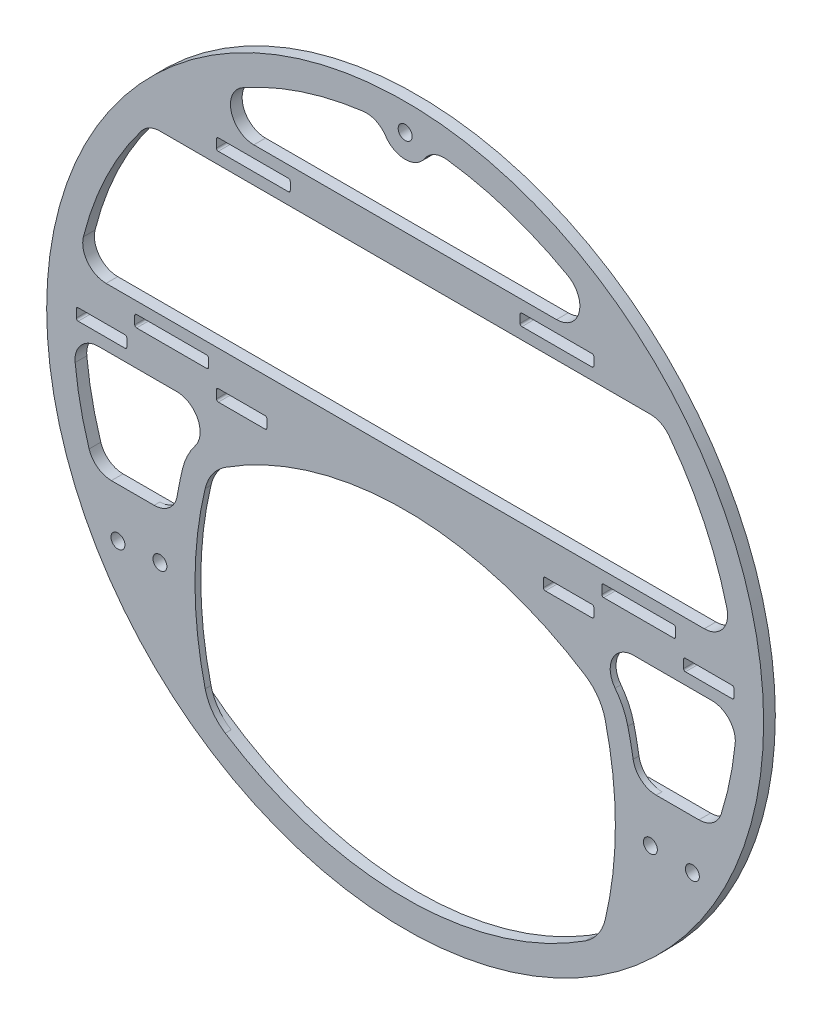
from build123d import *

# Parameters (mm, degrees)
SKETCH1_R             = 97.4725
SKETCH1_R_2           = 90.17
BOSS_EXTRUDE1_DEPTH   = 1.5875
BOSS_EXTRUDE2_START   = -3.175
BOSS_EXTRUDE2_DEPTH   = 3.175
CIRPATTERN2_COUNT     = 3
BOSS_EXTRUDE3_DEPTH   = 1.5875
BOSS_EXTRUDE4_START   = -3.175
BOSS_EXTRUDE4_DEPTH   = 3.175
FILLET2_R             = 6.35
F_6_CLEARANCE_HOLE1_D = 3.7973
BOSS_EXTRUDE5_START   = -3.175
SKETCH13_W            = 13.716
SKETCH13_H            = 3.175
BOSS_EXTRUDE5_DEPTH   = 3.175
SKETCH14_W            = 13.716
SKETCH14_H            = 3.175
CUT_EXTRUDE1_DEPTH    = 138.883491171
BOSS_EXTRUDE6_START   = -3.175
BOSS_EXTRUDE6_DEPTH   = 3.175
BOSS_EXTRUDE7_START   = -3.175
SKETCH16_W            = 20.066
SKETCH16_H            = 3.175
BOSS_EXTRUDE7_DEPTH   = 3.175
FILLET3_R             = 6.35
FILLET4_R             = 0.508


with BuildPart() as part:
    # Sketch1 → Boss-Extrude1 (new, symmetric)
    with BuildSketch(Plane.XY):
        Circle(SKETCH1_R)
        Circle(SKETCH1_R_2, mode=Mode.SUBTRACT)
    extrude(amount=BOSS_EXTRUDE1_DEPTH, both=True)

    # Sketch2 → Boss-Extrude2 (add)
    with BuildSketch(Plane.XY.offset(1.5875).offset(BOSS_EXTRUDE2_START)):
        with BuildLine():
            ThreePointArc((-5.291472464, 86.659612676), (0, 83.82), (5.291472464, 86.659612676))
            ThreePointArc((5.291472464, 86.659612676), (7.940261692, 88.923194985), (11.38468318, 89.448409091))
            ThreePointArc((11.38468318, 89.448409091), (0, 90.17), (-11.38468318, 89.448409091))
            ThreePointArc((-11.38468318, 89.448409091), (-7.940261692, 88.923194985), (-5.291472464, 86.659612676))
        make_face()
    boss_extrude2 = extrude(amount=BOSS_EXTRUDE2_DEPTH)

    # Sketch7 → #6 Clearance Hole2 (revolve, cut)
    with BuildSketch(Plane(origin=(0, 90.17, -1.5875), x_dir=(0, 1, 0), z_dir=(1, 0, 0))):
        Polygon((0, 0), (0, 7.490824014), (1.89865, 6.35), (1.89865, 0), align=None)
    f_6_clearance_hole2 = revolve(axis=Axis((0, 90.17, -7.9375), (0, 0, 1)), mode=Mode.SUBTRACT)

    # CirPattern2: Boss-Extrude2, #6 Clearance Hole2 ×3 about axis
    cirpattern2_axis = Axis((0, 0, 0), (0, 0, 1))
    add([boss_extrude2.rotate(cirpattern2_axis, i * 360 / CIRPATTERN2_COUNT) for i in range(1, CIRPATTERN2_COUNT)])
    add([f_6_clearance_hole2.rotate(cirpattern2_axis, i * 360 / CIRPATTERN2_COUNT) for i in range(1, CIRPATTERN2_COUNT)], mode=Mode.SUBTRACT)

    # Sketch9 → Boss-Extrude3 (add)
    with BuildSketch(Plane.XY):
        with BuildLine():
            ThreePointArc((60.552516274, -69.503424438), (63.5, -44.45), (60.552516274, -19.396575562))
            ThreePointArc((60.552516274, -19.396575562), (57.572960629, -12.81364776), (52.356101558, -7.813940596))
            ThreePointArc((52.356101558, -7.813940596), (0, 7.62), (-52.356101558, -7.813940596))
            ThreePointArc((-52.356101558, -7.813940596), (-57.572960629, -12.81364776), (-60.552516274, -19.396575562))
            ThreePointArc((-60.552516274, -19.396575562), (-63.5, -44.45), (-60.552516274, -69.503424438))
            ThreePointArc((-60.552516274, -69.503424438), (-57.572960629, -76.08635224), (-52.356101558, -81.086059404))
            ThreePointArc((-52.356101558, -81.086059404), (0, -96.52), (52.356101558, -81.086059404))
            ThreePointArc((52.356101558, -81.086059404), (57.572960629, -76.08635224), (60.552516274, -69.503424438))
        make_face()
        with BuildLine():
            ThreePointArc((48.911621193, -13.148549768), (0, 1.27), (-48.911621193, -13.148549768))
            ThreePointArc((-48.911621193, -13.148549768), (-52.38952724, -16.481687877), (-54.37589767, -20.870306412))
            ThreePointArc((-54.37589767, -20.870306412), (-57.15, -44.45), (-54.37589767, -68.029693588))
            ThreePointArc((-54.37589767, -68.029693588), (-52.38952724, -72.418312123), (-48.911621193, -75.751450232))
            ThreePointArc((-48.911621193, -75.751450232), (0, -90.17), (48.911621193, -75.751450232))
            ThreePointArc((48.911621193, -75.751450232), (52.38952724, -72.418312123), (54.37589767, -68.029693588))
            ThreePointArc((54.37589767, -68.029693588), (57.15, -44.45), (54.37589767, -20.870306412))
            ThreePointArc((54.37589767, -20.870306412), (52.38952724, -16.481687877), (48.911621193, -13.148549768))
        make_face(mode=Mode.SUBTRACT)
    extrude(amount=BOSS_EXTRUDE3_DEPTH)

    # Sketch10 → Boss-Extrude4 (add)
    with BuildSketch(Plane.XY.offset(1.5875).offset(BOSS_EXTRUDE4_START)):
        with BuildLine():
            Line((-62.750338152, -31.75), (-84.395298447, -31.75))
            ThreePointArc((-84.395298447, -31.75), (-83.790591931, -33.31314461), (-83.156936191, -34.864779698))
            ThreePointArc((-83.156936191, -34.864779698), (-80.979876688, -37.585129154), (-77.695162292, -38.747256761))
            ThreePointArc((-77.695162292, -38.747256761), (-72.590249345, -41.91), (-72.403689828, -47.912355915))
            ThreePointArc((-72.403689828, -47.912355915), (-73.039614996, -51.33806583), (-71.772253011, -54.583629393))
            ThreePointArc((-71.772253011, -54.583629393), (-66.786565118, -60.582040406), (-61.301141923, -66.127141923))
            ThreePointArc((-61.301141923, -66.127141923), (-63.404208023, -48.996681395), (-62.750338152, -31.75))
        make_face()
        with BuildLine():
            Line((84.395298447, -31.75), (62.750338152, -31.75))
            ThreePointArc((62.750338152, -31.75), (63.404208023, -48.996681395), (61.301141923, -66.127141923))
            ThreePointArc((61.301141923, -66.127141923), (66.786565118, -60.582040406), (71.772253011, -54.583629393))
            ThreePointArc((71.772253011, -54.583629393), (73.039614996, -51.33806583), (72.403689828, -47.912355915))
            ThreePointArc((72.403689828, -47.912355915), (72.590249345, -41.91), (77.695162292, -38.747256761))
            ThreePointArc((77.695162292, -38.747256761), (80.979876688, -37.585129154), (83.156936191, -34.864779698))
            ThreePointArc((83.156936191, -34.864779698), (83.790591931, -33.31314461), (84.395298447, -31.75))
        make_face()
    extrude(amount=BOSS_EXTRUDE4_DEPTH)

    # Fillet2
    fillet2_edges = [part.edges().sort_by_distance(p)[0] for p in [
        (-62.750338152, -31.75, 0.79375),
        (-84.395298447, -31.75, 0),
        (84.395298447, -31.75, 0),
        (62.750338152, -31.75, 0.79375),
    ]]
    fillet(fillet2_edges, radius=FILLET2_R)

    # #6 Clearance Hole1 (through all)
    with Locations(Plane.XY.offset(1.5875)):
        with Locations((-66.675, -44.45), (66.675, -44.45)):
            Hole(F_6_CLEARANCE_HOLE1_D / 2)

    # Sketch13 → Boss-Extrude5 (add)
    with BuildSketch(Plane.XY.offset(1.5875).offset(BOSS_EXTRUDE5_START)):
        with BuildLine():
            Line((-90.149874515, -1.905), (90.149874515, -1.905))
            ThreePointArc((90.149874515, -1.905), (90.124584486, 2.86149807), (89.847451272, 7.62))
            Line((89.847451272, 7.62), (-89.847451272, 7.62))
            ThreePointArc((-89.847451272, 7.62), (-90.124584486, 2.86149807), (-90.149874515, -1.905))
        make_face()
        with Locations((-82.55, 2.8575)):
            Rectangle(SKETCH13_W, SKETCH13_H, mode=Mode.SUBTRACT)
        with Locations((82.55, 2.8575)):
            Rectangle(SKETCH13_W, SKETCH13_H, mode=Mode.SUBTRACT)
        with Locations((-44.45, 2.8575)):
            Rectangle(SKETCH13_W, SKETCH13_H, mode=Mode.SUBTRACT)
        with Locations((44.45, 2.8575)):
            Rectangle(SKETCH13_W, SKETCH13_H, mode=Mode.SUBTRACT)
    extrude(amount=BOSS_EXTRUDE5_DEPTH)

    # Sketch14 → Cut-Extrude1 (cut, through all)
    with BuildSketch(Plane.XY.offset(1.5875)):
        with BuildLine():
            Line((-23.717058734, -1.905), (23.717058734, -1.905))
            ThreePointArc((23.717058734, -1.905), (0, 1.27), (-23.717058734, -1.905))
        make_face()
        with Locations((-82.55, 2.8575)):
            Rectangle(SKETCH14_W, SKETCH14_H)
        with Locations((82.55, 2.8575)):
            Rectangle(SKETCH14_W, SKETCH14_H)
    extrude(amount=-CUT_EXTRUDE1_DEPTH, mode=Mode.SUBTRACT)

    # Sketch15 → Boss-Extrude6 (add)
    with BuildSketch(Plane.XY.offset(1.5875).offset(BOSS_EXTRUDE6_START)):
        with BuildLine():
            Line((89.081243817, 13.97), (-89.081243817, 13.97))
            ThreePointArc((-89.081243817, 13.97), (-89.5206686, 10.801795844), (-89.847451272, 7.62))
            Line((-89.847451272, 7.62), (-73.533, 7.62))
            Line((-73.533, 7.62), (-73.533, 10.795))
            Line((-73.533, 10.795), (-53.467, 10.795))
            Line((-53.467, 10.795), (-53.467, 7.62))
            Line((-53.467, 7.62), (53.467, 7.62))
            Line((53.467, 7.62), (53.467, 10.795))
            Line((53.467, 10.795), (73.533, 10.795))
            Line((73.533, 10.795), (73.533, 7.62))
            Line((73.533, 7.62), (89.847451272, 7.62))
            ThreePointArc((89.847451272, 7.62), (89.5206686, 10.801795844), (89.081243817, 13.97))
        make_face()
    extrude(amount=BOSS_EXTRUDE6_DEPTH)

    # Sketch16 → Boss-Extrude7 (add)
    with BuildSketch(Plane.XY.offset(1.5875).offset(BOSS_EXTRUDE7_START)):
        with BuildLine():
            Line((-60.704804382, 66.675), (60.704804382, 66.675))
            ThreePointArc((60.704804382, 66.675), (65.399047227, 62.0773189), (69.746013506, 57.15))
            Line((69.746013506, 57.15), (-69.746013506, 57.15))
            ThreePointArc((-69.746013506, 57.15), (-65.399047227, 62.0773189), (-60.704804382, 66.675))
        make_face()
        with Locations((-41.275, 61.9125)):
            Rectangle(SKETCH16_W, SKETCH16_H, mode=Mode.SUBTRACT)
        with Locations((41.275, 61.9125)):
            Rectangle(SKETCH16_W, SKETCH16_H, mode=Mode.SUBTRACT)
    extrude(amount=BOSS_EXTRUDE7_DEPTH)

    # Fillet3
    # the kernel refuses this fillet: 6.35 mm, written as the material it adds along each edge
    with BuildSketch(Plane(origin=(-90.149874515, -1.905, -1.5875), x_dir=(0.05985075276270443, -0.9982073368763315, 0), z_dir=(0, 0, 1))) as fillet3_piece_1:
        with BuildLine():
            CenterArc((6.74185273, 6.345231116), FILLET3_R, 176.568753865, 95.65192799)
            Line((0.40323614, 6.725283396), (0, 0))
            ThreePointArc((0, 0), (3.493952874, -0.067718157), (6.987905749, 0))
        make_face()
    extrude(amount=3.175)
    with BuildSketch(Plane(origin=(90.149874515, -1.905, -1.5875), x_dir=(-1, 0, 0), z_dir=(0, 0, 1))) as fillet3_piece_2:
        with BuildLine():
            CenterArc((6.737361215, 6.35), FILLET3_R, 174.34807201, 95.65192799)
            ThreePointArc((0.418231419, 6.975378788), (0.141518948, 3.491742377), (0, 0))
            Line((0, 0), (6.737361215, 0))
        make_face()
    extrude(amount=3.175)
    with BuildSketch(Plane(origin=(41.808855222, -1.905, 1.5875), x_dir=(1, 0, 0), z_dir=(0, 0, -1))) as fillet3_piece_3:
        with BuildLine():
            CenterArc((20.287675039, 6.35), FILLET3_R, 142.214475454, 127.785524546)
            Line((15.269207589, 10.240692028), (14.767360844, 10.62976123))
            ThreePointArc((14.767360844, 10.62976123), (10.202798299, 6.442401513), (-0.275058258, 0.572335526))
            Line((-0.275058258, 0.572335526), (0, -0.635))
            Line((0, -0.635), (20.287675039, -0.635))
            Line((20.287675039, -0.635), (20.287675039, 0))
        make_face()
    extrude(amount=1.5875)
    with BuildSketch(Plane(origin=(-41.808855222, -1.905, 1.5875), x_dir=(-1, 0, 0), z_dir=(0, 0, -1))) as fillet3_piece_4:
        with BuildLine():
            CenterArc((20.287675039, -6.35), FILLET3_R, 90, 127.785524546)
            Line((15.269207589, -10.240692028), (14.767360844, -10.62976123))
            ThreePointArc((14.767360844, -10.62976123), (10.202798299, -6.442401513), (-0.275058258, -0.572335526))
            Line((-0.275058258, -0.572335526), (0, 0.635))
            Line((0, 0.635), (20.287675039, 0.635))
            Line((20.287675039, 0.635), (20.287675039, 0))
        make_face()
    extrude(amount=1.5875)
    with BuildSketch(Plane(origin=(-89.081243817, 13.97, -1.5875), x_dir=(0.19887515210932474, 0.9800248332942859, 0), z_dir=(0, 0, 1))) as fillet3_piece_5:
        with BuildLine():
            CenterArc((7.766740311, -6.343670211), FILLET3_R, 87.4415233, 104.029665401)
            Line((1.543582619, -7.606527427), (0, 0))
            ThreePointArc((0, 0), (4.025098993, 0.089883004), (8.050197986, 0))
        make_face()
    extrude(amount=3.175)
    with BuildSketch(Plane(origin=(89.081243817, 13.97, -1.5875), x_dir=(-0.19887515210932458, 0.9800248332942859, 0), z_dir=(0, 0, 1))) as fillet3_piece_6:
        with BuildLine():
            CenterArc((7.766740311, 6.343670211), FILLET3_R, 168.528811299, 104.029665401)
            Line((1.543582619, 7.606527427), (0, 0))
            ThreePointArc((0, 0), (4.025098993, -0.089883004), (8.050197986, 0))
        make_face()
    extrude(amount=3.175)
    with BuildSketch(Plane(origin=(69.746013506, 57.15, -1.5875), x_dir=(0.6200286205127284, -0.7845791927811258, 0), z_dir=(0, 0, 1))) as fillet3_piece_7:
        with BuildLine():
            CenterArc((3.076086715, -6.34900751), FILLET3_R, 88.986976441, 52.694799034)
            Line((-1.905991159, -2.41182577), (0, 0))
            ThreePointArc((0, 0), (1.594176327, 0.014093361), (3.188352654, 0))
        make_face()
    extrude(amount=3.175)
    with BuildSketch(Plane(origin=(-69.746013506, 57.15, -1.5875), x_dir=(-0.6200286205127318, -0.7845791927811233, 0), z_dir=(0, 0, 1))) as fillet3_piece_8:
        with BuildLine():
            CenterArc((3.076086715, 6.34900751), FILLET3_R, 218.318224525, 52.694799034)
            Line((-1.905991159, 2.41182577), (0, 0))
            ThreePointArc((0, 0), (1.594176327, -0.014093361), (3.188352654, 0))
        make_face()
    extrude(amount=3.175)
    with BuildSketch(Plane(origin=(-60.704804382, 66.675, -1.5875), x_dir=(0.8104674174729727, 0.5857837188030154, 0), z_dir=(0, 0, 1))) as fillet3_piece_9:
        with BuildLine():
            CenterArc((19.570038198, -6.309704304), FILLET3_R, 83.541821772, 150.599802763)
            Line((15.850311583, -11.456172405), (0, 0))
            ThreePointArc((0, 0), (10.142136584, 0.57219888), (20.284273168, 0))
        make_face()
    extrude(amount=3.175)
    with BuildSketch(Plane(origin=(60.704804382, 66.675, -1.5875), x_dir=(-0.8104674174729726, 0.5857837188030154, 0), z_dir=(0, 0, 1))) as fillet3_piece_10:
        with BuildLine():
            CenterArc((19.570038198, 6.309704304), FILLET3_R, 125.858375465, 150.599802763)
            Line((15.850311583, 11.456172405), (0, 0))
            ThreePointArc((0, 0), (10.142136584, -0.57219888), (20.284273168, 0))
        make_face()
    extrude(amount=3.175)

    # Fillet4
    fillet4_edges = [part.edges().sort_by_distance(p)[0] for p in [
        (-89.408, 1.27, 0),
        (-75.692, 1.27, 0),
        (-75.692, 4.445, 0),
        (-89.408, 4.445, 0),
        (-51.308, 1.27, 0),
        (-37.592, 1.27, 0),
        (-37.592, 4.445, 0),
        (-51.308, 4.445, 0),
        (89.408, 4.445, 0),
        (75.692, 4.445, 0),
        (75.692, 1.27, 0),
        (89.408, 1.27, 0),
        (51.308, 4.445, 0),
        (37.592, 4.445, 0),
        (37.592, 1.27, 0),
        (51.308, 1.27, 0),
        (73.533, 7.62, 0),
        (73.533, 10.795, 0),
        (53.467, 10.795, 0),
        (53.467, 7.62, 0),
        (-53.467, 7.62, 0),
        (-53.467, 10.795, 0),
        (-73.533, 10.795, 0),
        (-73.533, 7.62, 0),
        (-51.308, 60.325, 0),
        (-31.242, 60.325, 0),
        (-31.242, 63.5, 0),
        (-51.308, 63.5, 0),
        (31.242, 60.325, 0),
        (51.308, 60.325, 0),
        (51.308, 63.5, 0),
        (31.242, 63.5, 0),
    ]]
    fillet(fillet4_edges, radius=FILLET4_R)


solid = part.part
